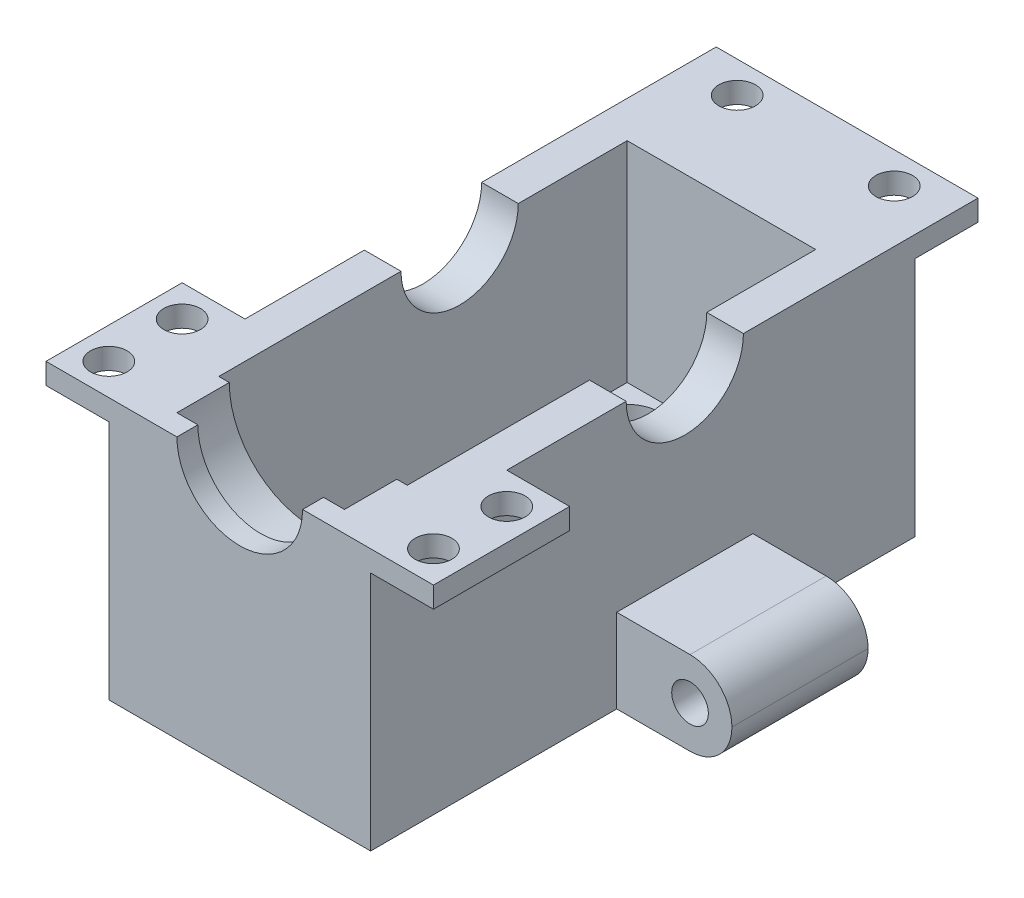
from build123d import *

# Parameters (mm, degrees)
CROQUIS2_W                 = 25
CROQUIS2_H                 = 50
SALIENTE_EXTRUIR2_DEPTH    = 25
CROQUIS21_W                = 25
CROQUIS21_H                = 25
SALIENTE_EXTRUIR11_DEPTH   = 6
CROQUIS4_W                 = 39
CROQUIS4_H                 = 20
CORTAR_EXTRUIR1_DEPTH      = 9
CORTAR_EXTRUIR2_DEPTH      = 42.740268327
CORTAR_EXTRUIR2_DEPTH_BACK = 42.740268327
CROQUIS9_R                 = 8
CORTAR_EXTRUIR3_DEPTH      = 5
SALIENTE_EXTRUIR12_DEPTH   = 2
CROQUIS11_W                = 13
CROQUIS11_H                = 2
SALIENTE_EXTRUIR4_DEPTH    = 6
CROQUIS12_R                = 1.75
CORTAR_EXTRUIR4_DEPTH      = 46.345892868
CROQUIS13_W                = 13
CROQUIS13_H                = 2
SALIENTE_EXTRUIR5_DEPTH    = 6
CROQUIS14_R                = 1.75
CORTAR_EXTRUIR5_DEPTH      = 46.345892868
CROQUIS16_R                = 1.75
CORTAR_EXTRUIR6_DEPTH      = 46.345892868
CROQUIS24_R                = 1.75
CORTAR_EXTRUIR8_DEPTH      = 43.793106922
CROQUIS25_W                = 25
CROQUIS25_H                = 23
CORTAR_EXTRUIR9_DEPTH      = 6
CROQUIS28_W                = 13
CROQUIS28_H                = 8
SALIENTE_EXTRUIR13_DEPTH   = 11
REDONDEO1_R                = 4
CROQUIS29_R                = 1.75
CORTAR_EXTRUIR10_DEPTH     = 51.094909921
REDONDEO1_OF_SIMETR_A1_R   = 4
CROQUIS30_R                = 3.1
CORTAR_EXTRUIR11_DEPTH     = 3


with BuildPart() as part:
    # Croquis2 → Saliente-Extruir2 (new body)
    with BuildSketch(Plane(origin=(0, 0, 0), x_dir=(1, 0, 0), z_dir=(0, 1, 0))):
        Rectangle(CROQUIS2_W, CROQUIS2_H)
    extrude(amount=SALIENTE_EXTRUIR2_DEPTH)

    # Croquis21 → Saliente-Extruir11 (add)
    with BuildSketch(Plane.XY.offset(25)):
        with Locations((0, 12.5)):
            Rectangle(CROQUIS21_W, CROQUIS21_H)
    extrude(amount=SALIENTE_EXTRUIR11_DEPTH)

    # Croquis4 → Cortar-Extruir1 (cut, symmetric)
    with BuildSketch(Plane(origin=(0, 0, 0), x_dir=(0, 0, -1), z_dir=(1, 0, 0))):
        with Locations((-6.5, 15)):
            Rectangle(CROQUIS4_W, CROQUIS4_H)
    extrude(amount=CORTAR_EXTRUIR1_DEPTH, both=True, mode=Mode.SUBTRACT)

    # Croquis5 → Cortar-Extruir2 (cut, two sides: drawn at the far end of the back side and taken through both)
    with BuildSketch(Plane(origin=(0, 0, 0), x_dir=(0, 0, -1), z_dir=(1, 0, 0)).offset(-CORTAR_EXTRUIR2_DEPTH_BACK)):
        with BuildLine():
            ThreePointArc((2.6, 25), (-3, 30.6), (-8.6, 25))
            Line((-8.6, 25), (2.6, 25))
        make_face()
        with BuildLine():
            Line((2.6, 25), (-8.6, 25))
            ThreePointArc((-8.6, 25), (-3, 19.4), (2.6, 25))
        make_face()
    extrude(amount=CORTAR_EXTRUIR2_DEPTH + CORTAR_EXTRUIR2_DEPTH_BACK, mode=Mode.SUBTRACT)

    # Croquis9 → Cortar-Extruir3 (cut)
    with BuildSketch(Plane.XY.offset(31)):
        with Locations((0, 25)):
            Circle(CROQUIS9_R)
    extrude(amount=-CORTAR_EXTRUIR3_DEPTH, mode=Mode.SUBTRACT)

    # Croquis23 → Saliente-Extruir12 (add)
    with BuildSketch(Plane.XY.offset(31)):
        with BuildLine():
            Line((12.5, 25), (6, 25))
            ThreePointArc((6, 25), (0, 19), (-6, 25))
            Line((-6, 25), (-12.5, 25))
            Line((-12.5, 25), (-12.5, 0))
            Line((-12.5, 0), (12.5, 0))
            Line((12.5, 0), (12.5, 25))
        make_face()
    extrude(amount=SALIENTE_EXTRUIR12_DEPTH)

    # Croquis11 → Saliente-Extruir4 (add)
    with BuildSketch(Plane(origin=(12.5, 0, 0), x_dir=(0, 0, -1), z_dir=(1, 0, 0))):
        with Locations((-26.5, 24)):
            Rectangle(CROQUIS11_W, CROQUIS11_H)
    extrude(amount=SALIENTE_EXTRUIR4_DEPTH)

    # Croquis12 → Cortar-Extruir4 (cut, through all)
    with BuildSketch(Plane(origin=(0, 25, 0), x_dir=(1, 0, 0), z_dir=(0, 1, 0))):
        with Locations(Location((15.5, -23, 0), (0, 0, 270))):
            Circle(CROQUIS12_R)
        with Locations(Location((15.5, -30, 0), (0, 0, 270))):
            Circle(CROQUIS12_R)
    extrude(amount=-CORTAR_EXTRUIR4_DEPTH, mode=Mode.SUBTRACT)

    # Croquis13 → Saliente-Extruir5 (add)
    with BuildSketch(Plane.ZY.offset(12.5)):
        with Locations((26.5, 24)):
            Rectangle(CROQUIS13_W, CROQUIS13_H)
    extrude(amount=SALIENTE_EXTRUIR5_DEPTH)

    # Croquis14 → Cortar-Extruir5 (cut, through all)
    with BuildSketch(Plane(origin=(0, 25, 0), x_dir=(1, 0, 0), z_dir=(0, 1, 0))):
        with Locations(Location((-15.5, -23, 0), (0, 0, 270))):
            Circle(CROQUIS14_R)
        with Locations(Location((-15.5, -30, 0), (0, 0, 270))):
            Circle(CROQUIS14_R)
    extrude(amount=-CORTAR_EXTRUIR5_DEPTH, mode=Mode.SUBTRACT)

    # Croquis16 → Cortar-Extruir6 (cut, through all)
    with BuildSketch(Plane(origin=(0, 25, 0), x_dir=(1, 0, 0), z_dir=(0, 1, 0))):
        with Locations(Location((-7.5, 22, 0), (0, 0, 270))):
            Circle(CROQUIS16_R)
        with Locations(Location((7.5, 22, 0), (0, 0, 270))):
            Circle(CROQUIS16_R)
    extrude(amount=-CORTAR_EXTRUIR6_DEPTH, mode=Mode.SUBTRACT)

    # Croquis24 → Cortar-Extruir8 (cut, through all)
    with BuildSketch(Plane(origin=(0, 5, 0), x_dir=(1, 0, 0), z_dir=(0, 1, 0))):
        with Locations(Location((-5, -22, 0), (0, 0, 270))):
            Circle(CROQUIS24_R)
        with Locations(Location((-5, 9, 0), (0, 0, 270))):
            Circle(CROQUIS24_R)
        with Locations(Location((5, -22, 0), (0, 0, 270))):
            Circle(CROQUIS24_R)
        with Locations(Location((5, 9, 0), (0, 0, 270))):
            Circle(CROQUIS24_R)
    extrude(amount=-CORTAR_EXTRUIR8_DEPTH, mode=Mode.SUBTRACT)

    # Croquis25 → Cortar-Extruir9 (cut)
    with BuildSketch(Plane(origin=(0, 0, -25), x_dir=(-1, 0, 0), z_dir=(0, 0, -1))):
        with Locations((0, 11.5)):
            Rectangle(CROQUIS25_W, CROQUIS25_H)
    extrude(amount=-CORTAR_EXTRUIR9_DEPTH, mode=Mode.SUBTRACT)

    # Croquis28 → Saliente-Extruir13 (add)
    with BuildSketch(Plane(origin=(12.5, 0, 0), x_dir=(0, 0, -1), z_dir=(1, 0, 0))):
        with Locations((-3, 4)):
            Rectangle(CROQUIS28_W, CROQUIS28_H)
    saliente_extruir13 = extrude(amount=SALIENTE_EXTRUIR13_DEPTH)

    # Redondeo1
    redondeo1_edges = [part.edges().sort_by_distance(p)[0] for p in [
        (23.5, 0, 3),
        (23.5, 8, 3),
    ]]
    fillet(redondeo1_edges, radius=REDONDEO1_R - 0.0001)  # a hair under: the kernel refuses the full size

    # Croquis29 → Cortar-Extruir10 (cut, through all)
    with BuildSketch(Plane(origin=(0, 0, -3.5), x_dir=(-1, 0, 0), z_dir=(0, 0, -1))):
        with Locations(Location((-19.5, 4, 0), (0, 0, 90))):
            Circle(CROQUIS29_R)
    cortar_extruir10 = extrude(amount=-CORTAR_EXTRUIR10_DEPTH, mode=Mode.SUBTRACT)

    # Simetría1: Saliente-Extruir13, Cortar-Extruir10 across plane
    add(saliente_extruir13.mirror(Plane.ZY))
    add(cortar_extruir10.mirror(Plane.ZY), mode=Mode.SUBTRACT)

    # Redondeo1 of Simetría1
    redondeo1_of_simetr_a1_edges = [part.edges().sort_by_distance(p)[0] for p in [
        (-23.5, 0, 3),
        (-23.5, 8, 3),
    ]]
    fillet(redondeo1_of_simetr_a1_edges, radius=REDONDEO1_OF_SIMETR_A1_R - 0.0001)  # a hair under: the kernel refuses the full size

    # Croquis30 → Cortar-Extruir11 (cut)
    with BuildSketch(Plane(origin=(0, 5, 0), x_dir=(1, 0, 0), z_dir=(0, 1, 0))):
        with Locations(Location((-5, 9, 0), (0, 0, 270))):
            Circle(CROQUIS30_R)
        with Locations(Location((-5, -22, 0), (0, 0, 270))):
            Circle(CROQUIS30_R)
        with Locations(Location((5, -22, 0), (0, 0, 270))):
            Circle(CROQUIS30_R)
        with Locations(Location((5, 9, 0), (0, 0, 270))):
            Circle(CROQUIS30_R)
    extrude(amount=-CORTAR_EXTRUIR11_DEPTH, mode=Mode.SUBTRACT)


solid = part.part
